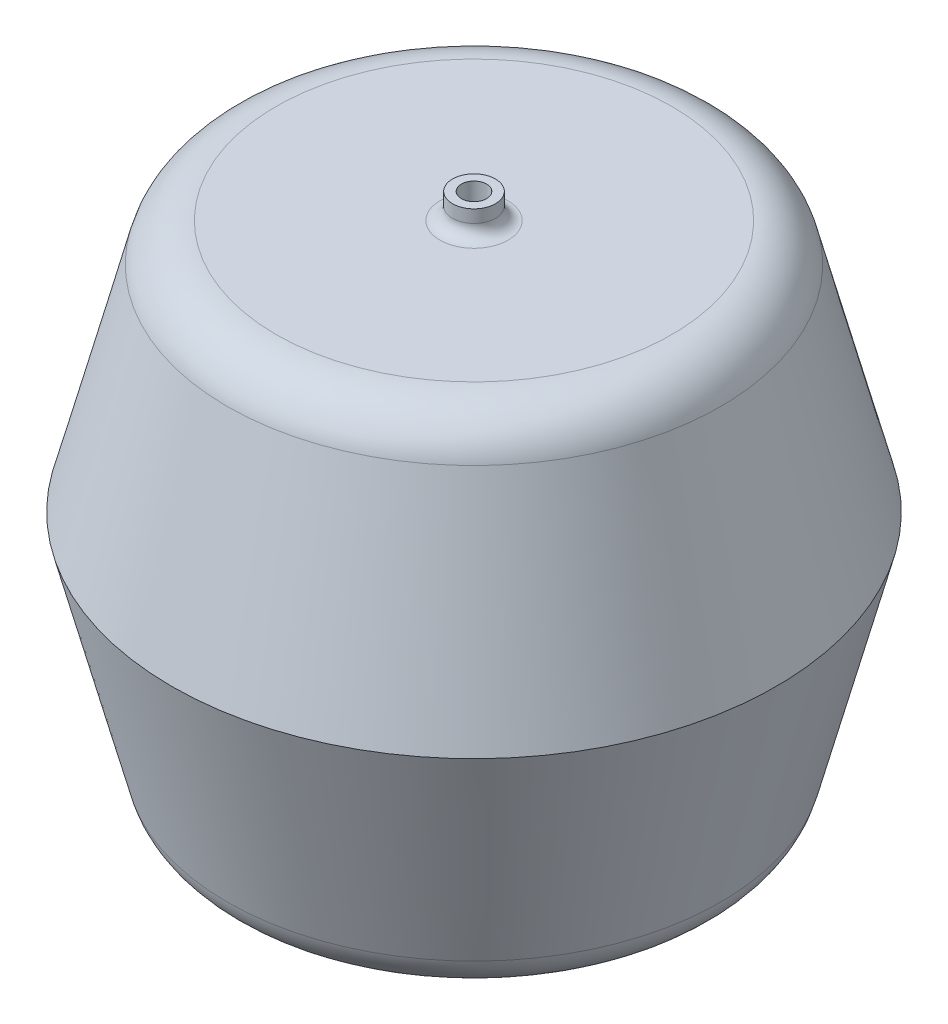
from build123d import *

# Parameters (mm, degrees)
FILLET1_R           = 50.8
SKETCH2_R           = 152.019
BOSS_EXTRUDE1_DEPTH = 25.4
SKETCH3_R           = 21.59
BOSS_EXTRUDE2_DEPTH = 25.4
FILLET2_R           = 12.7
SKETCH4_R           = 12.7
CUT_EXTRUDE1_DEPTH  = 38.1


with BuildPart() as part:
    # Sketch1 → Revolve1 (revolve)
    with BuildSketch(Plane.XY):
        Polygon((0, 0), (238.29772, 0), (304.038, 254), (238.29772, 508), (0, 508), (0, 495.3), (228.466256152, 495.3), (290.919522152, 254), (228.466256152, 12.7), (0, 12.7), align=None)
    revolve(axis=Axis((0, 508, 0), (0, -1, 0)))

    # Fillet1
    fillet1_edges = [part.edges().sort_by_distance(p)[0] for p in [
        (-238.29772, 0, 0),
        (-238.29772, 508, 0),
    ]]
    fillet(fillet1_edges, radius=FILLET1_R)

    # Sketch2 → Boss-Extrude1 (add)
    with BuildSketch(Plane.XZ):
        Circle(SKETCH2_R)
    extrude(amount=BOSS_EXTRUDE1_DEPTH)

    # Sketch3 → Boss-Extrude2 (add)
    with BuildSketch(Plane(origin=(0, 508, 0), x_dir=(1, 0, 0), z_dir=(0, 1, 0))):
        Circle(SKETCH3_R)
    extrude(amount=BOSS_EXTRUDE2_DEPTH)

    # Fillet2
    fillet2_edges = [part.edges().sort_by_distance(p)[0] for p in [
        (-21.59, 508, 0),
    ]]
    fillet(fillet2_edges, radius=FILLET2_R)

    # Sketch4 → Cut-Extrude1 (cut)
    with BuildSketch(Plane(origin=(0, 533.4, 0), x_dir=(1, 0, 0), z_dir=(0, 1, 0))):
        Circle(SKETCH4_R)
    extrude(amount=-CUT_EXTRUDE1_DEPTH, mode=Mode.SUBTRACT)


solid = part.part
